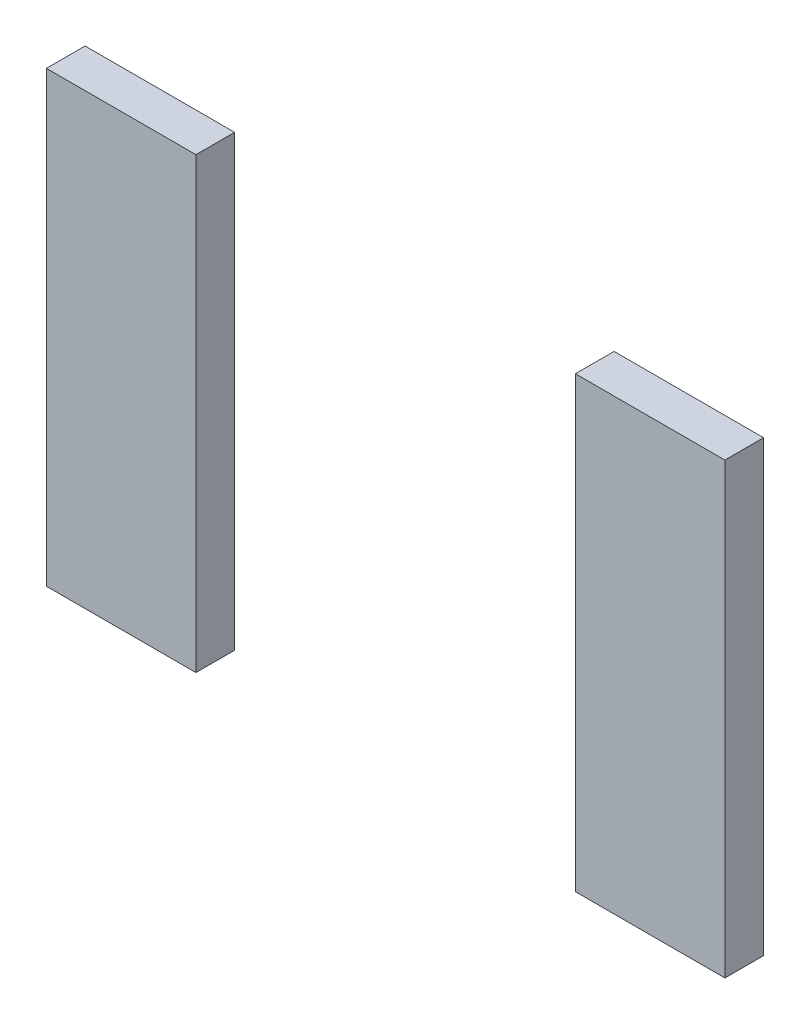
from build123d import *

# Parameters (mm, degrees)
SKETCH1_W             = 12.7
SKETCH1_H             = 38.1
BOSS_EXTRUDE1_DEPTH   = 3.28676
BOSS_EXTRUDE1_2_DEPTH = 3.28676


with BuildPart() as part:
    # Sketch1 → Boss-Extrude1 (new body)
    with BuildSketch(Plane.XY):
        with Locations((22.465, 0)):
            Rectangle(SKETCH1_W, SKETCH1_H)
    extrude(amount=BOSS_EXTRUDE1_DEPTH)


with BuildPart() as body_2:
    # Sketch1 → Boss-Extrude1 2 (new body)
    with BuildSketch(Plane.XY):
        with Locations((-22.465, 0)):
            Rectangle(SKETCH1_W, SKETCH1_H)
    extrude(amount=BOSS_EXTRUDE1_2_DEPTH)


solid = Compound([part.part, body_2.part])
